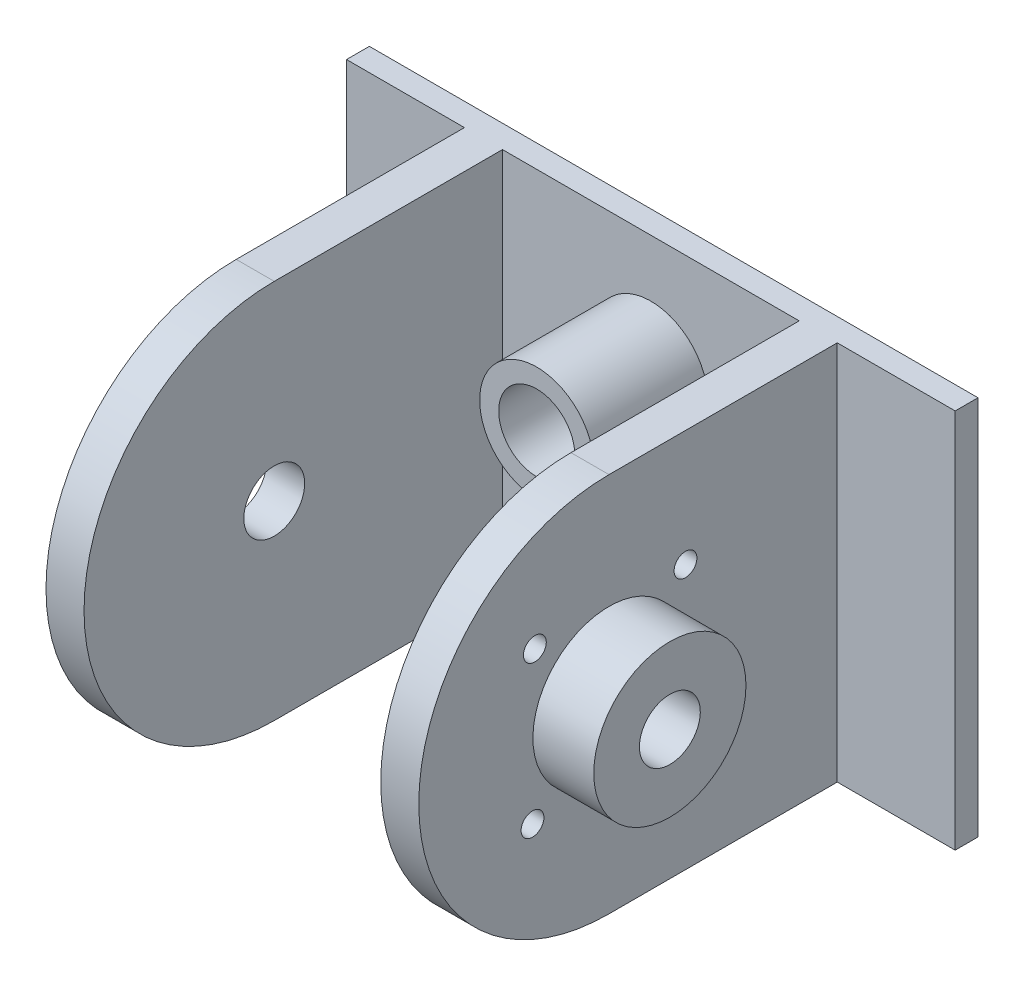
from build123d import *
from build123d.topology import SkipClean

# Parameters (mm, degrees)
SKETCH1_W              = 49
SKETCH1_H              = 50
BOSS_EXTRUDE1_DEPTH    = 3
SKETCH2_W              = 5
SKETCH2_H              = 50
BOSS_EXTRUDE2_DEPTH    = 55
SKETCH3_OUTSIDE_W      = 78.182
SKETCH3_OUTSIDE_H      = 70.182
SKETCH3_OUTSIDE_R      = 4
CUT_EXTRUDE1_DEPTH     = 80.937475567
SKETCH4_R              = 7.5
SKETCH4_R_2            = 5
BOSS_EXTRUDE3_DEPTH    = 15
SKETCH5_R              = 10
SKETCH5_R_2            = 4
BOSS_EXTRUDE4_DEPTH    = 8
CUT_EXTRUDE2_START     = -5
CUT_EXTRUDE2_OUTLINE_R = 1.5
CUT_EXTRUDE2_DEPTH     = 5
SKETCH7_W              = 80
SKETCH7_H              = 50
BOSS_EXTRUDE5_DEPTH    = 3


# Read off the part's stored shape, not the designer's step: Cut-Extrude2
with BuildPart() as part:
    # Sketch1 → Boss-Extrude1 (new body)
    with BuildSketch(Plane.XY):
        Rectangle(SKETCH1_W, SKETCH1_H)
    extrude(amount=BOSS_EXTRUDE1_DEPTH)

    # Sketch2 → Boss-Extrude2 (add)
    with BuildSketch(Plane.XY.offset(3)):
        with Locations((-22, 0)):
            Rectangle(SKETCH2_W, SKETCH2_H)
        with Locations((22, 0)):
            Rectangle(SKETCH2_W, SKETCH2_H)
    extrude(amount=BOSS_EXTRUDE2_DEPTH)

    # Sketch3 outside → Cut-Extrude1 (cut, through all)
    # profile 1 of 2: a face of its own
    with BuildSketch(Plane.ZY.offset(24.5)):
        with Locations((29, 0)):
            Rectangle(SKETCH3_OUTSIDE_W, SKETCH3_OUTSIDE_H)
        with BuildLine():
            Line((0, 25), (0, -25))
            Line((0, -25), (33, -25))
            ThreePointArc((33, -25), (58, 0), (33, 25))
            Line((33, 25), (0, 25))
        make_face(mode=Mode.SUBTRACT)
    # profile 2 of 2: a face of its own
    with BuildSketch(Plane.ZY.offset(24.5)):
        with Locations((33, 0)):
            Circle(SKETCH3_OUTSIDE_R)
    extrude(amount=-CUT_EXTRUDE1_DEPTH, mode=Mode.SUBTRACT)

    # Sketch4 → Boss-Extrude3 (add)
    with BuildSketch(Plane.XY.offset(3)):
        with Locations((0, 10)):
            Circle(SKETCH4_R)
        with Locations((0, 10)):
            Circle(SKETCH4_R_2, mode=Mode.SUBTRACT)
    extrude(amount=BOSS_EXTRUDE3_DEPTH)

    # Sketch5 → Boss-Extrude4 (add)
    with SkipClean():  # the faces are left unmerged after this step: merging them gives an invalid solid
        with BuildSketch(Plane(origin=(24.5, 0, 0), x_dir=(0, 0, -1), z_dir=(1, 0, 0))):
            with Locations(Location((-33, 0, 0), (0, 0, 270))):
                Circle(SKETCH5_R)
            with Locations(Location((-33, 0, 0), (0, 0, 90))):
                Circle(SKETCH5_R_2, mode=Mode.SUBTRACT)
        extrude(amount=BOSS_EXTRUDE4_DEPTH)

    # Cut-Extrude2 outline → Cut-Extrude2 (cut)
    with SkipClean():  # the faces are left unmerged after this step: merging them gives an invalid solid
        with BuildSketch(Plane(origin=(24.5, 0, 0), x_dir=(0, 0, -1), z_dir=(1, 0, 0)).offset(CUT_EXTRUDE2_START)):
            with Locations((-42.744235689, 10.052356482)):
                Circle(CUT_EXTRUDE2_OUTLINE_R)
            with Locations((-22.947643518, 9.744235689)):
                Circle(CUT_EXTRUDE2_OUTLINE_R)
            with Locations((-23.255764311, -10.052356482)):
                Circle(CUT_EXTRUDE2_OUTLINE_R)
            with Locations((-43.052356482, -9.744235689)):
                Circle(CUT_EXTRUDE2_OUTLINE_R)
        extrude(amount=CUT_EXTRUDE2_DEPTH, mode=Mode.SUBTRACT)

    # Sketch7 → Boss-Extrude5 (add)
    with SkipClean():  # the faces are left unmerged after this step: merging them gives an invalid solid
        with BuildSketch(Plane(origin=(0, 0, 0), x_dir=(-1, 0, 0), z_dir=(0, 0, -1))):
            Rectangle(SKETCH7_W, SKETCH7_H)
        extrude(amount=-BOSS_EXTRUDE5_DEPTH)


solid = part.part
